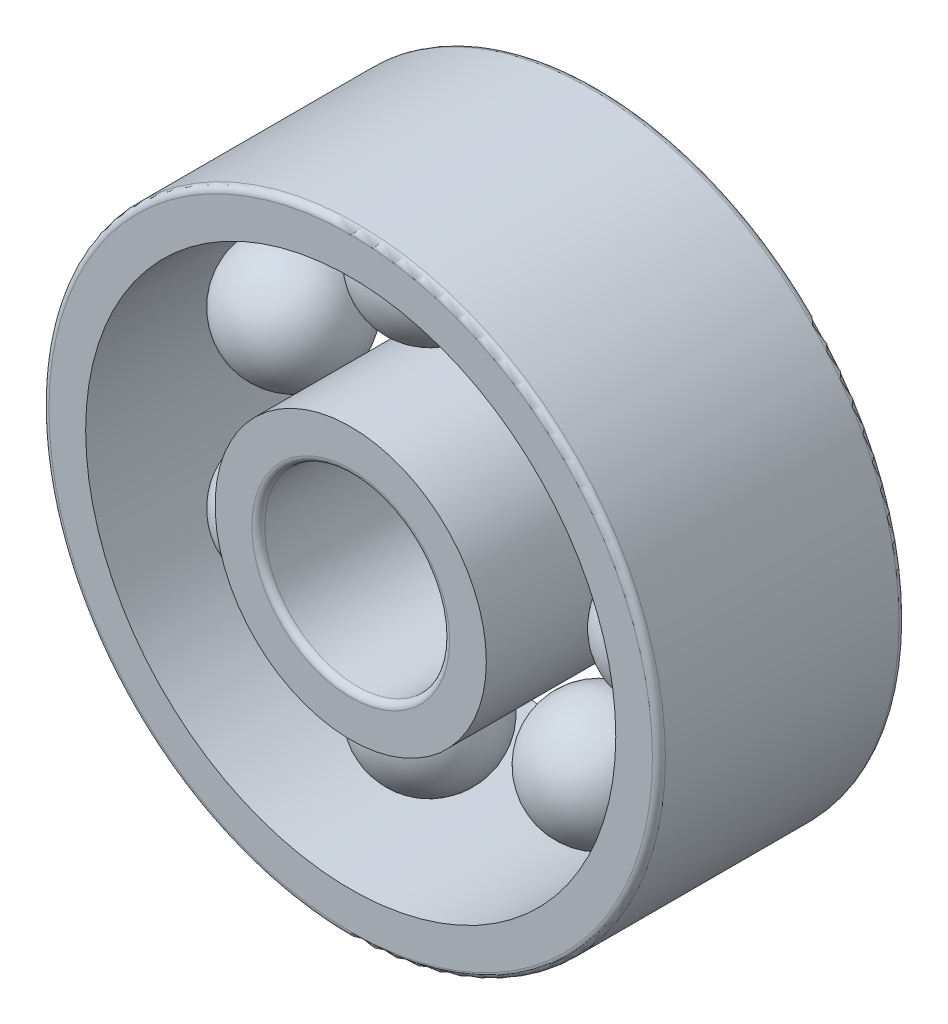
from build123d import *

# Parameters (mm, degrees)
INNERS_W           = 0.7
INNERS_H           = 4
OUTERS_W           = 0.7
OUTERS_H           = 4
BALLSPATTERN_COUNT = 7
FILLET_F1_R        = 0.105
FILLET_F2_R        = 0.105


with BuildPart() as part:
    # InnerS → InnerRing (revolve)
    with BuildSketch(Plane(origin=(0, 0, 0), x_dir=(1, 0, 0), z_dir=(0, 1, 0))):
        with Locations((1.85, 0)):
            Rectangle(INNERS_W, INNERS_H)
    revolve(axis=Axis((0, 0, 4), (0, 0, -1)))

    # Fillet F2
    fillet_f2_edges = [part.edges().sort_by_distance(p)[0] for p in [
        (-1.5, 0, -2),
        (-1.5, 0, 2),
    ]]
    fillet(fillet_f2_edges, radius=FILLET_F2_R)


with BuildPart() as body_2:
    # OuterS → OuterRing (revolve)
    with BuildSketch(Plane(origin=(0, 0, 0), x_dir=(1, 0, 0), z_dir=(0, 1, 0))):
        with Locations((4.65, 0)):
            Rectangle(OUTERS_W, OUTERS_H)
    revolve(axis=Axis((0, 0, 4), (0, 0, -1)))

    # Fillet F1
    fillet_f1_edges = [body_2.edges().sort_by_distance(p)[0] for p in [
        (-5, 0, -2),
        (-5, 0, 2),
    ]]
    fillet(fillet_f1_edges, radius=FILLET_F1_R)


with BuildPart() as body_3:
    # BallS → Ball (revolve)
    with BuildSketch(Plane(origin=(0, 0, 0), x_dir=(1, 0, 0), z_dir=(0, 1, 0))):
        with BuildLine():
            Line((2.2525, 0), (4.2475, 0))
            ThreePointArc((4.2475, 0), (3.25, -0.9975), (2.2525, 0))
        make_face()
    revolve(axis=Axis((2.2525, 0, 0), (1, 0, 0)))


with BuildPart() as ballspattern_1:
    # BallsPattern: pattern copy
    add(body_3.part.rotate(Axis((0, 0, -2.2), (0, 0, 1)), 1 * 360 / BALLSPATTERN_COUNT))


with BuildPart() as ballspattern_2:
    # BallsPattern: pattern copy
    add(body_3.part.rotate(Axis((0, 0, -2.2), (0, 0, 1)), 2 * 360 / BALLSPATTERN_COUNT))


with BuildPart() as ballspattern_3:
    # BallsPattern: pattern copy
    add(body_3.part.rotate(Axis((0, 0, -2.2), (0, 0, 1)), 3 * 360 / BALLSPATTERN_COUNT))


with BuildPart() as ballspattern_4:
    # BallsPattern: pattern copy
    add(body_3.part.rotate(Axis((0, 0, -2.2), (0, 0, 1)), 4 * 360 / BALLSPATTERN_COUNT))


with BuildPart() as ballspattern_5:
    # BallsPattern: pattern copy
    add(body_3.part.rotate(Axis((0, 0, -2.2), (0, 0, 1)), 5 * 360 / BALLSPATTERN_COUNT))


with BuildPart() as ballspattern_6:
    # BallsPattern: pattern copy
    add(body_3.part.rotate(Axis((0, 0, -2.2), (0, 0, 1)), 6 * 360 / BALLSPATTERN_COUNT))


solid = Compound([part.part, body_2.part, body_3.part, ballspattern_1.part, ballspattern_2.part, ballspattern_3.part, ballspattern_4.part, ballspattern_5.part, ballspattern_6.part])
